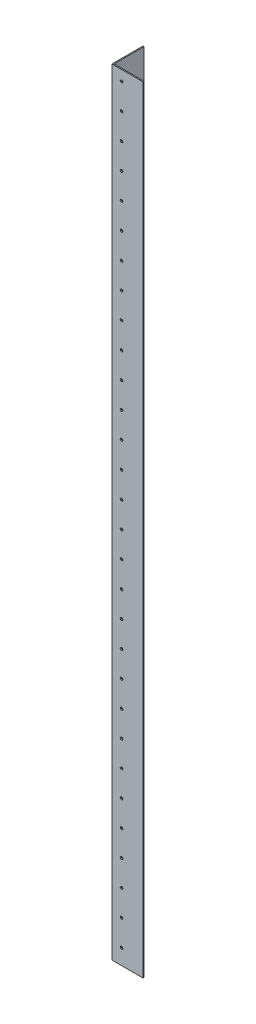
from build123d import *

# Parameters (mm, degrees)
EXTRUDE_1_DEPTH     = 1500
SKETCH_2_R          = 2.5
CUT_EXTRUDE_1_DEPTH = 1503.398083066
SKETCH_3_R          = 2.5
CUT_EXTRUDE_2_DEPTH = 1503.398083066


with BuildPart() as part:
    # Эскиз1 → Вытянуть-Тонкостенный1 (new body)
    with BuildSketch(Plane(origin=(0, 0, 0), x_dir=(1, 0, 0), z_dir=(0, 1, 0))):
        Polygon((0, 60), (0, 0), (60, 0), (60, 2), (2, 2), (2, 60), align=None)
    extrude(amount=EXTRUDE_1_DEPTH)

    # Эскиз2 → Вырез-Вытянуть1 (cut, through all)
    with BuildSketch(Plane.ZY):
        with Locations((-18.5, 30)):
            Circle(SKETCH_2_R)
        with Locations((-18.5, 80)):
            Circle(SKETCH_2_R)
        with Locations((-18.5, 130)):
            Circle(SKETCH_2_R)
        with Locations((-18.5, 180)):
            Circle(SKETCH_2_R)
        with Locations((-18.5, 230)):
            Circle(SKETCH_2_R)
        with Locations((-18.5, 280)):
            Circle(SKETCH_2_R)
        with Locations((-18.5, 330)):
            Circle(SKETCH_2_R)
        with Locations((-18.5, 380)):
            Circle(SKETCH_2_R)
        with Locations((-18.5, 430)):
            Circle(SKETCH_2_R)
        with Locations((-18.5, 480)):
            Circle(SKETCH_2_R)
        with Locations((-18.5, 530)):
            Circle(SKETCH_2_R)
        with Locations((-18.5, 580)):
            Circle(SKETCH_2_R)
        with Locations((-18.5, 630)):
            Circle(SKETCH_2_R)
        with Locations((-18.5, 680)):
            Circle(SKETCH_2_R)
        with Locations((-18.5, 730)):
            Circle(SKETCH_2_R)
        with Locations((-18.5, 780)):
            Circle(SKETCH_2_R)
        with Locations((-18.5, 830)):
            Circle(SKETCH_2_R)
        with Locations((-18.5, 880)):
            Circle(SKETCH_2_R)
        with Locations((-18.5, 930)):
            Circle(SKETCH_2_R)
        with Locations((-18.5, 980)):
            Circle(SKETCH_2_R)
        with Locations((-18.5, 1030)):
            Circle(SKETCH_2_R)
        with Locations((-18.5, 1080)):
            Circle(SKETCH_2_R)
        with Locations((-18.5, 1130)):
            Circle(SKETCH_2_R)
        with Locations((-18.5, 1180)):
            Circle(SKETCH_2_R)
        with Locations((-18.5, 1230)):
            Circle(SKETCH_2_R)
        with Locations((-18.5, 1280)):
            Circle(SKETCH_2_R)
        with Locations((-18.5, 1330)):
            Circle(SKETCH_2_R)
        with Locations((-18.5, 1380)):
            Circle(SKETCH_2_R)
        with Locations((-18.5, 1430)):
            Circle(SKETCH_2_R)
        with Locations((-18.5, 1480)):
            Circle(SKETCH_2_R)
    extrude(amount=-CUT_EXTRUDE_1_DEPTH, mode=Mode.SUBTRACT)

    # Эскиз3 → Вырез-Вытянуть2 (cut, through all)
    with BuildSketch(Plane.XY):
        with Locations((18.5, 30)):
            Circle(SKETCH_3_R)
        with Locations((18.5, 80)):
            Circle(SKETCH_3_R)
        with Locations((18.5, 130)):
            Circle(SKETCH_3_R)
        with Locations((18.5, 180)):
            Circle(SKETCH_3_R)
        with Locations((18.5, 230)):
            Circle(SKETCH_3_R)
        with Locations((18.5, 280)):
            Circle(SKETCH_3_R)
        with Locations((18.5, 330)):
            Circle(SKETCH_3_R)
        with Locations((18.5, 380)):
            Circle(SKETCH_3_R)
        with Locations((18.5, 430)):
            Circle(SKETCH_3_R)
        with Locations((18.5, 480)):
            Circle(SKETCH_3_R)
        with Locations((18.5, 530)):
            Circle(SKETCH_3_R)
        with Locations((18.5, 580)):
            Circle(SKETCH_3_R)
        with Locations((18.5, 630)):
            Circle(SKETCH_3_R)
        with Locations((18.5, 680)):
            Circle(SKETCH_3_R)
        with Locations((18.5, 730)):
            Circle(SKETCH_3_R)
        with Locations((18.5, 780)):
            Circle(SKETCH_3_R)
        with Locations((18.5, 830)):
            Circle(SKETCH_3_R)
        with Locations((18.5, 880)):
            Circle(SKETCH_3_R)
        with Locations((18.5, 930)):
            Circle(SKETCH_3_R)
        with Locations((18.5, 980)):
            Circle(SKETCH_3_R)
        with Locations((18.5, 1030)):
            Circle(SKETCH_3_R)
        with Locations((18.5, 1080)):
            Circle(SKETCH_3_R)
        with Locations((18.5, 1130)):
            Circle(SKETCH_3_R)
        with Locations((18.5, 1180)):
            Circle(SKETCH_3_R)
        with Locations((18.5, 1230)):
            Circle(SKETCH_3_R)
        with Locations((18.5, 1280)):
            Circle(SKETCH_3_R)
        with Locations((18.5, 1330)):
            Circle(SKETCH_3_R)
        with Locations((18.5, 1380)):
            Circle(SKETCH_3_R)
        with Locations((18.5, 1430)):
            Circle(SKETCH_3_R)
        with Locations((18.5, 1480)):
            Circle(SKETCH_3_R)
    extrude(amount=-CUT_EXTRUDE_2_DEPTH, mode=Mode.SUBTRACT)


solid = part.part
